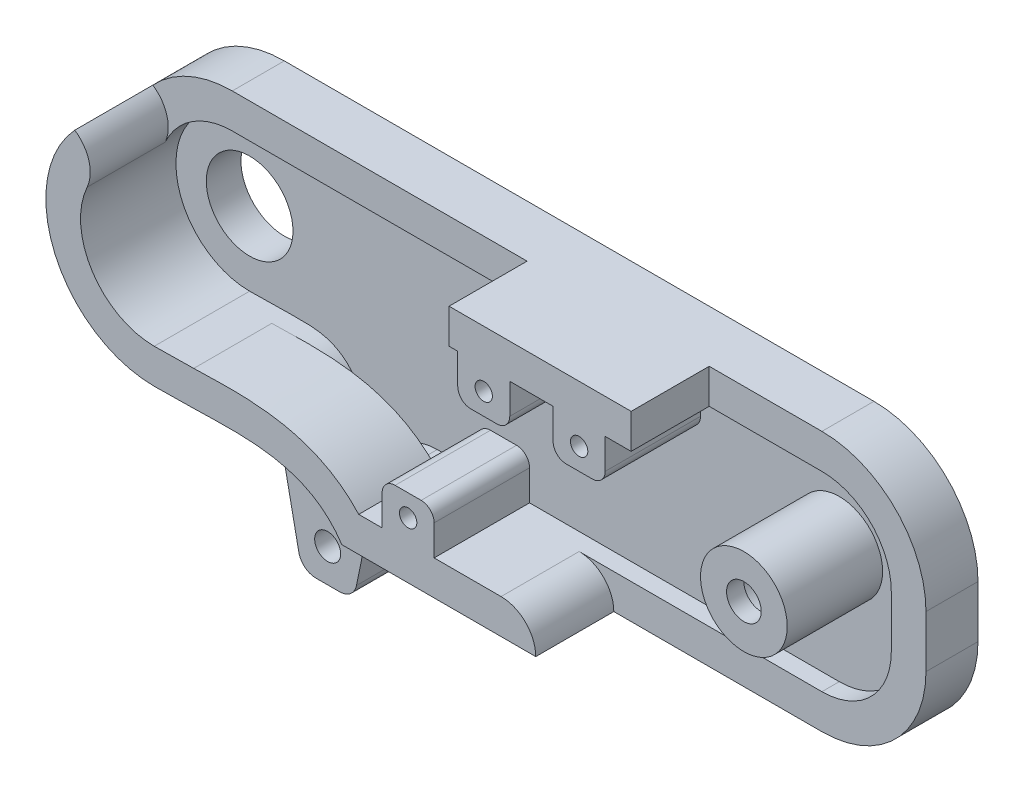
from build123d import *
from OCP.BRepAlgoAPI import BRepAlgoAPI_Cut
from OCP.TopTools import TopTools_ListOfShape

# Parameters (mm, degrees)
SKETCH1_R           = 0.75
SKETCH1_R_2         = 2.5
BOSS_EXTRUDE1_DEPTH = 7.5
CUT_EXTRUDE1_DEPTH  = 2.5
SHELL5_START        = 2
SHELL5_OUTLINE_R    = 2.5
SHELL5_DEPTH        = 5.5
SHELL5_2_DEPTH      = 1
CUT_EXTRUDE2_REACH  = 33.891
SKETCH3_W           = 12.5
SKETCH3_H           = 4.5
SKETCH4_W           = 22
SKETCH4_H           = 4.5
CUT_EXTRUDE3_DEPTH  = 2
SKETCH5_R           = 2.5
BOSS_EXTRUDE2_DEPTH = 7.5
SKETCH6_W           = 5.5
SKETCH6_H           = 4.5
CUT_EXTRUDE4_DEPTH  = 2
BOSS_EXTRUDE3_DEPTH = 7.5
SKETCH8_R           = 1
SKETCH8_R_2         = 1.5
CUT_EXTRUDE5_DEPTH  = 6.5
SKETCH9_R           = 1
SKETCH9_R_2         = 0.5
CUT_EXTRUDE6_DEPTH  = 1
FILLET1_R           = 2


with BuildPart() as part:
    # Sketch1 → Boss-Extrude1 (new body)
    with BuildSketch(Plane.XY):
        with BuildLine():
            Line((-17.5, 7.5), (16.5, 7.5))
            ThreePointArc((16.5, 7.5), (20.742640687, 5.742640687), (22.5, 1.5))
            Line((22.5, 1.5), (22.5, -1.5))
            ThreePointArc((22.5, -1.5), (20.742640687, -5.742640687), (16.5, -7.5))
            Line((16.5, -7.5), (-6.682881455, -7.5))
            ThreePointArc((-6.682881455, -7.5), (-7.315625918, -7.725639332), (-7.662826305, -8.300731111))
            Line((-7.662826305, -8.300731111), (-8.337173695, -11.61697006))
            ThreePointArc((-8.337173695, -11.61697006), (-8.684374082, -12.192061839), (-9.317118545, -12.41770117))
            Line((-9.317118545, -12.41770117), (-10.682881455, -12.41770117))
            ThreePointArc((-10.682881455, -12.41770117), (-11.315625918, -12.192061839), (-11.662826305, -11.61697006))
            Line((-11.662826305, -11.61697006), (-12.5, -7.5))
            add(Edge.make_bspline(
                [(-17.5, -5), (-14.320279304, -5), (-13.179751961, -4.660447797), (-12.769069707, -6.176795589), (-12.5, -7.5)],
                knots=[0, 0, 0, 0, 0.663630363, 1, 1, 1, 1], degree=3))
            ThreePointArc((-17.5, -5), (-23.75, 1.25), (-17.5, 7.5))
        make_face()
        with Locations((-10, -10.5)):
            Circle(SKETCH1_R, mode=Mode.SUBTRACT)
        with Locations((-17.5, 1.25)):
            Circle(SKETCH1_R_2, mode=Mode.SUBTRACT)
        with Locations((16.5, 1.25)):
            Circle(SKETCH1_R_2, mode=Mode.SUBTRACT)
    extrude(amount=BOSS_EXTRUDE1_DEPTH)

    # Sketch2 → Cut-Extrude1 (cut)
    with BuildSketch(Plane.XY.offset(7.5)):
        with BuildLine():
            Line((-15.178398269, -4.966090348), (-15.008472623, -12.710378991))
            Line((-15.008472623, -12.710378991), (-6.851113055, -12.710378991))
            Line((-6.851113055, -12.710378991), (-6.682881455, -7.5))
            add(Edge.make_bspline(
                [(-15.178398269, -4.966090348), (-14.120705321, -4.942882386), (-10.924994513, -4.797400334), (-7.886900282, -5.661870268), (-6.682881455, -7.5)],
                knots=[0, 0, 0, 0, 0.363164263, 1, 1, 1, 1], degree=3))
        make_face()
    extrude(amount=-CUT_EXTRUDE1_DEPTH, mode=Mode.SUBTRACT)


with BuildPart() as shell5_tool:
    # Shell5: read off the stored shape, not the designer's step
    # Shell5 outline → Shell5 (new body)
    with BuildSketch(Plane.XY.offset(SHELL5_START)):
        with BuildLine():
            ThreePointArc((-17.5, 5.5), (-21.75, 1.25), (-17.5, -3))
            add(Edge.make_bspline(
                [(-17.5, -3), (-17.279470214, -3), (-17.067607137, -2.999191358), (-16.864129639, -2.997686938), (-16.668767846, -2.99557937), (-16.481223243, -2.992977326), (-16.301191194, -2.989985538), (-16.128356468, -2.986704319), (-15.96238705, -2.98323319), (-15.802930702, -2.979672128), (-15.649611814, -2.976121667), (-15.502027076, -2.972683494), (-15.359739594, -2.96946243), (-15.22227185, -2.966570646)],
                knots=[0, 0, 0, 0, 0, 0, 0, 0, 0, 0, 0, 0, 0, 0, 0.205554911, 0.205554911, 0.205554911, 0.205554911, 0.205554911, 0.205554911, 0.205554911, 0.205554911, 0.205554911, 0.205554911, 0.205554911, 0.205554911, 0.205554911, 0.205554911], degree=13))
            add(Edge.make_bspline(
                [(-5.709186534, -5.500000403), (-6.306803382, -4.843784547), (-6.973897736, -4.291392484), (-7.693172142, -3.84840516), (-8.440659076, -3.51480441), (-9.190928646, -3.278430045), (-9.929269581, -3.113132637), (-10.666123962, -3.002227883), (-11.382986557, -2.942110529), (-12.089726768, -2.909817875), (-12.774471769, -2.906571366), (-13.437022906, -2.916899663), (-14.070436809, -2.935750402), (-14.668490575, -2.954420526), (-15.22227185, -2.966570646)],
                knots=[0.082765311, 0.082765311, 0.082765311, 0.082765311, 0.082765311, 0.082765311, 0.082765311, 0.082765311, 0.082765311, 0.082765311, 0.082765311, 0.082765311, 0.082765311, 0.082765311, 0.082765311, 1, 1, 1, 1, 1, 1, 1, 1, 1, 1, 1, 1, 1, 1, 1], degree=14))
            Line((-5.709186534, -5.500000403), (16.5, -5.5))
            ThreePointArc((16.5, -5.5), (19.328427125, -4.328427125), (20.5, -1.5))
            Line((20.5, -1.5), (20.5, 1.5))
            ThreePointArc((20.5, 1.5), (19.328427125, 4.328427125), (16.5, 5.5))
            Line((16.5, 5.5), (-17.5, 5.5))
        make_face()
        with Locations((-17.5, 1.25)):
            Circle(SHELL5_OUTLINE_R, mode=Mode.SUBTRACT)
        with Locations((16.5, 1.25)):
            Circle(SHELL5_OUTLINE_R, mode=Mode.SUBTRACT)
    extrude(amount=SHELL5_DEPTH)


with BuildPart() as part_1:
    add(part.part)

    # Shell5: cut by shell5_tool, with a tolerance
    shell5_stock = TopTools_ListOfShape()
    shell5_stock.Append(part_1.part.wrapped)
    shell5_tools = TopTools_ListOfShape()
    shell5_tools.Append(shell5_tool.part.wrapped)
    shell5_cut = BRepAlgoAPI_Cut()
    shell5_cut.SetArguments(shell5_stock)
    shell5_cut.SetTools(shell5_tools)
    shell5_cut.SetFuzzyValue(0.00001)
    shell5_cut.Build()
    add(Compound.cast(shell5_cut.Shape()).solids(), mode=Mode.REPLACE)


with BuildPart() as shell5_2_tool:
    # Shell5 2 outline → Shell5 2 (new body)
    with BuildSketch(Plane.XY.offset(SHELL5_START)):
        with BuildLine():
            add(Edge.make_bspline(
                [(-5.709186534, -5.500000403), (-6.306803382, -4.843784547), (-6.973897736, -4.291392484), (-7.693172142, -3.84840516), (-8.440659076, -3.51480441), (-9.190928646, -3.278430045), (-9.929269581, -3.113132637), (-10.666123962, -3.002227883), (-11.382986557, -2.942110529), (-12.089726768, -2.909817875), (-12.774471769, -2.906571366), (-13.437022906, -2.916899663), (-14.070436809, -2.935750402), (-14.668490575, -2.954420526), (-15.222271829, -2.966571628)],
                knots=[0.082765311, 0.082765311, 0.082765311, 0.082765311, 0.082765311, 0.082765311, 0.082765311, 0.082765311, 0.082765311, 0.082765311, 0.082765311, 0.082765311, 0.082765311, 0.082765311, 0.082765311, 1, 1, 1, 1, 1, 1, 1, 1, 1, 1, 1, 1, 1, 1, 1], degree=14))
            add(Edge.make_bspline(
                [(-15.222271829, -2.966571628), (-15.025357547, -2.962428338), (-14.83833279, -2.958961675), (-14.659794059, -2.956500348), (-14.488166809, -2.955404994), (-14.32166304, -2.956092632), (-14.15822898, -2.959081459), (-13.995488053, -2.965065745), (-13.830698575, -2.975031445), (-13.660752866, -2.990442743), (-13.48223072, -3.013640023), (-13.291856783, -3.048642759), (-13.089831496, -3.100937727), (-12.79104703, -3.205401917), (-12.700612898, -3.240326167), (-12.609092173, -3.279337505), (-12.516899457, -3.322674537), (-12.424583038, -3.370502546), (-12.332814819, -3.422867542), (-12.24235113, -3.479652273), (-12.153972725, -3.540554472), (-12.068414586, -3.605097454), (-11.986298452, -3.672673003), (-11.908083343, -3.742606279), (-11.83405162, -3.814222323), (-11.746925171, -3.905048863), (-11.729770648, -3.923279746), (-11.712888869, -3.941565965), (-11.696281313, -3.959897594), (-11.67994896, -3.978265019), (-11.663892291, -3.996658941), (-11.648111291, -4.015070369), (-11.632605445, -4.033490627), (-11.617373739, -4.051911353), (-11.602414662, -4.070324495), (-11.587726204, -4.088722314), (-11.573305857, -4.107097384), (-11.555611804, -4.130028893), (-11.552090335, -4.134612303), (-11.548583926, -4.139195778), (-11.545093818, -4.143777452), (-11.541621201, -4.14835553), (-11.538165937, -4.152930033), (-11.53472685, -4.157502402), (-11.531302807, -4.162074018), (-11.527893837, -4.166644675), (-11.524501528, -4.171212034), (-11.521127942, -4.175773102), (-11.517772295, -4.180328785), (-11.511076972, -4.189456261), (-11.507738296, -4.194026753), (-11.504408683, -4.198603868), (-11.50108821, -4.203187476), (-11.497776954, -4.207777444), (-11.494474993, -4.212373643), (-11.491182403, -4.216975942), (-11.487899261, -4.22158421), (-11.484625646, -4.226198316), (-11.481361632, -4.23081813), (-11.478107299, -4.23544352), (-11.474862722, -4.240074356), (-11.465158493, -4.25398281), (-11.458728267, -4.263276396), (-11.45233783, -4.272590223), (-11.445987678, -4.28192326), (-11.439678274, -4.291274495), (-11.433410047, -4.300642925), (-11.427183393, -4.310027565), (-11.420998674, -4.319427443), (-11.414856219, -4.328841601), (-11.408756324, -4.338269094), (-11.402699251, -4.347708993), (-11.396685229, -4.357160382), (-11.36683135, -4.404470274), (-11.34364027, -4.442488929), (-11.321153981, -4.480619234), (-11.299376993, -4.518808994), (-11.278306459, -4.557012823), (-11.257933085, -4.595192075), (-11.238242039, -4.633314757), (-11.219213849, -4.671355451), (-11.200825322, -4.709295239), (-11.183050439, -4.747121618), (-11.165861271, -4.784828422), (-11.149228878, -4.822415746), (-11.068705603, -5.009786324), (-11.012727418, -5.157860709), (-10.963295043, -5.304390346), (-10.918354242, -5.451002576), (-10.876276421, -5.599861249), (-10.835871925, -5.753181253), (-10.796238753, -5.913010135), (-10.75663953, -6.081186972), (-10.71645131, -6.2593826), (-10.675150687, -6.44914195), (-10.632280916, -6.651888726), (-10.587398117, -6.868914865), (-10.540110299, -7.101462221)],
                knots=[0.205554911, 0.205554911, 0.205554911, 0.205554911, 0.205554911, 0.205554911, 0.205554911, 0.205554911, 0.205554911, 0.205554911, 0.205554911, 0.205554911, 0.205554911, 0.205554911, 0.5, 0.5, 0.5, 0.5, 0.5, 0.5, 0.5, 0.5, 0.5, 0.5, 0.5, 0.5, 0.625, 0.625, 0.625, 0.625, 0.625, 0.625, 0.625, 0.625, 0.625, 0.625, 0.625, 0.625, 0.65625, 0.65625, 0.65625, 0.65625, 0.65625, 0.65625, 0.65625, 0.65625, 0.65625, 0.65625, 0.65625, 0.65625, 0.6640625, 0.6640625, 0.6640625, 0.6640625, 0.6640625, 0.6640625, 0.6640625, 0.6640625, 0.6640625, 0.6640625, 0.6640625, 0.6640625, 0.671875, 0.671875, 0.671875, 0.671875, 0.671875, 0.671875, 0.671875, 0.671875, 0.671875, 0.671875, 0.671875, 0.671875, 0.6875, 0.6875, 0.6875, 0.6875, 0.6875, 0.6875, 0.6875, 0.6875, 0.6875, 0.6875, 0.6875, 0.6875, 0.75, 0.75, 0.75, 0.75, 0.75, 0.75, 0.75, 0.75, 0.75, 0.75, 0.75, 0.75, 1, 1, 1, 1, 1, 1, 1, 1, 1, 1, 1, 1, 1, 1], degree=13))
            Line((-10.540110299, -7.101462221), (-10.402218376, -7.779573493))
            ThreePointArc((-10.402218376, -7.779573493), (-9.998689871, -7.750000312), (-9.595189727, -7.77995797))
            ThreePointArc((-9.595189727, -7.77995797), (-8.53218861, -6.137784293), (-6.682881455, -5.5))
            Line((-6.682881455, -5.5), (-5.709186534, -5.500000403))
        make_face()
    extrude(amount=SHELL5_2_DEPTH)


with BuildPart() as part_2:
    add(part_1.part)

    # Shell5 2: cut by shell5_2_tool, with a tolerance
    shell5_2_stock = TopTools_ListOfShape()
    shell5_2_stock.Append(part_2.part.wrapped)
    shell5_2_tools = TopTools_ListOfShape()
    shell5_2_tools.Append(shell5_2_tool.part.wrapped)
    shell5_2_cut = BRepAlgoAPI_Cut()
    shell5_2_cut.SetArguments(shell5_2_stock)
    shell5_2_cut.SetTools(shell5_2_tools)
    shell5_2_cut.SetFuzzyValue(0.00001)
    shell5_2_cut.Build()
    add(Compound.cast(shell5_2_cut.Shape()).solids(), mode=Mode.REPLACE)

    # Cut-Extrude2: up to this face of the body (flat: up to its plane)
    cut_extrude2_end = Plane(part_2.part.faces().sort_by_distance((4.908559273, -7.5, 3.75))[0])
    # Sketch3 → Cut-Extrude2 (cut, up to the picked face)
    with BuildSketch(Plane(origin=(0, 7.5, 0), x_dir=(1, 0, 0), z_dir=(0, 1, 0)), mode=Mode.PRIVATE) as cut_extrude2_sk1:
        with Locations((16.25, -5.25)):
            Rectangle(SKETCH3_W, SKETCH3_H)
    cut_extrude2_tool1 = split(extrude(cut_extrude2_sk1.sketch, amount=-CUT_EXTRUDE2_REACH, mode=Mode.PRIVATE), bisect_by=cut_extrude2_end, keep=Keep.BOTH, mode=Mode.PRIVATE)
    add(cut_extrude2_tool1.solids().sort_by(Axis((16.25, 7.5, 5.25), (0, -1, 0)))[0], mode=Mode.SUBTRACT)

    # Sketch4 → Cut-Extrude3 (cut)
    with BuildSketch(Plane(origin=(0, 7.5, 0), x_dir=(1, 0, 0), z_dir=(0, 1, 0))):
        with Locations((-11.5, -5.25)):
            Rectangle(SKETCH4_W, SKETCH4_H)
    extrude(amount=-CUT_EXTRUDE3_DEPTH, mode=Mode.SUBTRACT)

    # Sketch5 → Boss-Extrude2 (add)
    with BuildSketch(Plane.XY):
        with Locations((16.5, 1.25)):
            Circle(SKETCH5_R)
    extrude(amount=BOSS_EXTRUDE2_DEPTH)

    # Sketch6 → Cut-Extrude4 (cut)
    with BuildSketch(Plane.XZ.offset(7.5)):
        with Locations((7.25, 5.25)):
            Rectangle(SKETCH6_W, SKETCH6_H)
    extrude(amount=-CUT_EXTRUDE4_DEPTH, mode=Mode.SUBTRACT)


with BuildPart() as boss_extrude3_tool:
    # Sketch7 → Boss-Extrude3 (new body)
    with BuildSketch(Plane.XY):
        with BuildLine():
            Line((0, 5.5), (3, 5.5))
            Line((3, 5.5), (3, 3.75))
            ThreePointArc((3, 3.75), (2.780330086, 3.219669914), (2.25, 3))
            Line((2.25, 3), (0.75, 3))
            ThreePointArc((0.75, 3), (0.219669914, 3.219669914), (0, 3.75))
            Line((0, 3.75), (0, 5.5))
        make_face()
        with BuildLine():
            Line((-4.359237177, -5.5), (-1.359237177, -5.5))
            Line((-1.359237177, -5.5), (-1.359237177, -3.75))
            ThreePointArc((-1.359237177, -3.75), (-1.578907091, -3.219669914), (-2.109237177, -3))
            Line((-2.109237177, -3), (-3.609237177, -3))
            ThreePointArc((-3.609237177, -3), (-4.139567263, -3.219669914), (-4.359237177, -3.75))
            Line((-4.359237177, -3.75), (-4.359237177, -5.5))
        make_face()
        with BuildLine():
            Line((5.5, 5.5), (8.5, 5.5))
            Line((8.5, 5.5), (8.5, 3.75))
            ThreePointArc((8.5, 3.75), (8.280330086, 3.219669914), (7.75, 3))
            Line((7.75, 3), (6.25, 3))
            ThreePointArc((6.25, 3), (5.719669914, 3.219669914), (5.5, 3.75))
            Line((5.5, 3.75), (5.5, 5.5))
        make_face()
    extrude(amount=BOSS_EXTRUDE3_DEPTH)


with BuildPart() as part_3:
    add(part_2.part)


with BuildPart() as part_4:
    # Boss-Extrude3: joined with boss_extrude3_tool
    add(part_3.part.fuse(boss_extrude3_tool.part, tol=0.00001))

    # Sketch8 → Cut-Extrude5 (cut)
    with BuildSketch(Plane.XY):
        with Locations((1.5, 4.25)):
            Circle(SKETCH8_R)
        with Locations((7, 4.25)):
            Circle(SKETCH8_R)
        with Locations((-2.859237177, -4.25)):
            Circle(SKETCH8_R)
        with Locations((16.5, 1.25)):
            Circle(SKETCH8_R_2)
    extrude(amount=CUT_EXTRUDE5_DEPTH, mode=Mode.SUBTRACT)

    # Sketch9 → Cut-Extrude6 (cut)
    with BuildSketch(Plane.XY.offset(7.5)):
        with Locations((16.5, 1.25)):
            Circle(SKETCH9_R)
        with Locations((7, 4.25)):
            Circle(SKETCH9_R_2)
        with Locations((1.5, 4.25)):
            Circle(SKETCH9_R_2)
        with Locations((-2.859237177, -4.25)):
            Circle(SKETCH9_R_2)
    extrude(amount=-CUT_EXTRUDE6_DEPTH, mode=Mode.SUBTRACT)

    # Fillet1
    # the kernel refuses this fillet: 2 mm, written as the material it takes off along each edge
    with BuildSketch(Plane(origin=(4.5, -5.5, 12.500000091), x_dir=(-0.999999999999992, -1.2701951171309344e-07, 0), z_dir=(0, 0, -1))) as fillet1_piece_1:
        with BuildLine():
            CenterArc((2.000000254, -2), FILLET1_R, 90.000006238, 89.999993762)
            Line((2.54e-07, -2), (0, 0))
            Line((0, 0), (2.000000036, 0))
        make_face()
    extrude(amount=9.500000091, mode=Mode.SUBTRACT)
    with BuildSketch(Plane(origin=(-17.5, 5.5, 3), x_dir=(-1, 0, 0), z_dir=(0, 0, 1))) as fillet1_piece_2:
        with BuildLine():
            CenterArc((5.690426959, 1.6651323), FILLET1_R, 155.570149399, 80.793103779)
            ThreePointArc((3.869490332, 2.492289964), (2.301329219, 0.676992328), (0, 0))
            Line((0, 0), (4.582575695, 0))
        make_face()
    extrude(amount=16.006646094, mode=Mode.SUBTRACT)


solid = part_4.part
